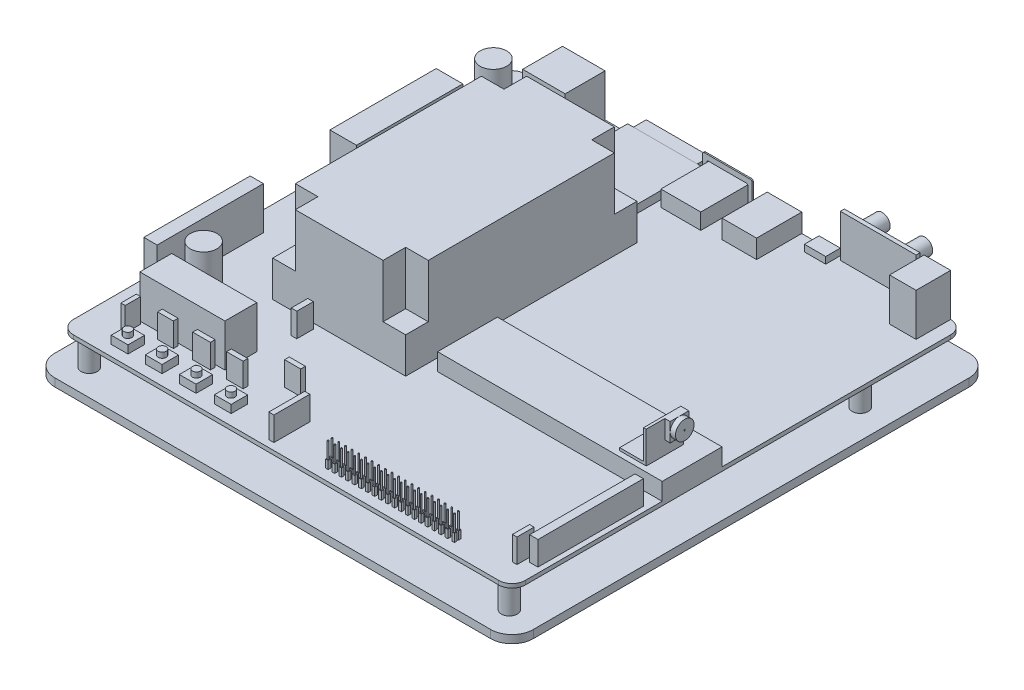
from build123d import *

# Parameters (mm, degrees)
RESSALTO_EXTRUS_O1_DEPTH  = 3
ESBO_O2_R                 = 3.5
RESSALTO_EXTRUS_O2_DEPTH  = 5
ESBO_O3_R                 = 3
RESSALTO_EXTRUS_O3_DEPTH  = 11
RESSALTO_EXTRUS_O4_DEPTH  = 1.5
ESBO_O5_W                 = 50
ESBO_O5_H                 = 87
RESSALTO_EXTRUS_O5_DEPTH  = 33.5
ESBO_O6_W                 = 8.5
ESBO_O6_H                 = 8.5
CORTE_EXTRUS_O1_DEPTH     = 20
ESBO_O7_W                 = 6.3
ESBO_O7_H                 = 6.2
RESSALTO_EXTRUS_O6_DEPTH  = 3
ESBO_O8_R                 = 1.5
RESSALTO_EXTRUS_O7_DEPTH  = 2
ESBO_O9_W                 = 1
ESBO_O9_H                 = 1
RESSALTO_EXTRUS_O8_DEPTH  = 3
ESBO_O10_R                = 0.25
RESSALTO_EXTRUS_O9_DEPTH  = 6
PADR_O_LINEAR1_COUNT      = 20
PADR_O_LINEAR1_PITCH      = 2.5
PADR_O_LINEAR1_COUNT_DIR2 = 2
PADR_O_LINEAR1_PITCH_DIR2 = 1.5
ESBO_O11_R                = 5
ESBO_O11_W                = 32
ESBO_O11_H                = 12
ESBO_O11_W_2              = 5
ESBO_O11_H_2              = 40
ESBO_O11_W_3              = 10
ESBO_O11_W_4              = 16
ESBO_O11_H_3              = 15
ESBO_O11_H_4              = 13
ESBO_O11_W_5              = 28.5
ESBO_O11_H_5              = 1.5
RESSALTO_EXTRUS_O10_DEPTH = 16
ESBO_O12_R                = 3
RESSALTO_EXTRUS_O11_DEPTH = 8
ESBO_O13_W                = 1.63158932
ESBO_O13_H                = 5.78472577
ESBO_O13_W_2              = 5.933052072
ESBO_O13_H_2              = 1.779915621
ESBO_O13_W_3              = 6.674683581
ESBO_O13_W_4              = 6.229704676
ESBO_O13_W_5              = 1.928241924
ESBO_O13_H_3              = 13.497693464
ESBO_O13_W_6              = 6.081378375
ESBO_O13_H_4              = 1.779915622
ESBO_O13_W_7              = 2.076568226
ESBO_O13_H_5              = 6.229704676
ESBO_O13_W_8              = 3.125695858
ESBO_O13_H_6              = 39.6558734
ESBO_O13_W_9              = 1.699808413
ESBO_O13_H_7              = 6.437326086
RESSALTO_EXTRUS_O12_DEPTH = 9
ESBO_O14_W                = 84.5
ESBO_O14_H                = 22.5
RESSALTO_EXTRUS_O13_DEPTH = 6.5
ESBO_O15_W                = 1
ESBO_O15_H                = 14
RESSALTO_EXTRUS_O14_DEPTH = 12
ESBO_O16_W                = 14
ESBO_O16_H                = 1
RESSALTO_EXTRUS_O15_DEPTH = 9
ESBO_O17_W                = 7
ESBO_O17_H                = 7
RESSALTO_EXTRUS_O16_DEPTH = 2
ESBO_O18_R                = 3.5
RESSALTO_EXTRUS_O17_DEPTH = 2
ESBO_O19_R                = 0.35
ESBO_O19_R_2              = 0.25
CORTE_EXTRUS_O2_DEPTH     = 0.2
RESSALTO_EXTRUS_O18_DEPTH = 3
ESBO_O21_W                = 24
ESBO_O21_H                = 0.2
CORTE_EXTRUS_O3_DEPTH     = 5
ESBO_O22_W                = 15
ESBO_O22_H                = 18
RESSALTO_EXTRUS_O19_DEPTH = 6
ESBO_O23_W                = 13
ESBO_O23_H                = 17
RESSALTO_EXTRUS_O20_DEPTH = 7
ESBO_O24_W                = 8
ESBO_O24_H                = 5.5
RESSALTO_EXTRUS_O21_DEPTH = 2.5
ESBO_O25_W                = 10
ESBO_O25_H                = 0.5
CORTE_EXTRUS_O4_DEPTH     = 8.5
RESSALTO_EXTRUS_O22_DEPTH = 0.5
ESBO_O27_W                = 12.6
ESBO_O27_H                = 6.6
ESBO_O27_W_2              = 10.6
ESBO_O27_H_2              = 1.5
CORTE_EXTRUS_O5_DEPTH     = 10
CORTE_EXTRUS_O6_DEPTH     = 4


with BuildPart() as part:
    # Esboço1 → Ressalto-extrusão1 (new body)
    with BuildSketch(Plane(origin=(0, 0, 0), x_dir=(1, 0, 0), z_dir=(0, 1, 0))):
        with BuildLine():
            Line((82, -90), (-82, -90))
            ThreePointArc((-82, -90), (-87.656854249, -87.656854249), (-90, -82))
            Line((-90, -82), (-90, 82))
            ThreePointArc((-90, 82), (-87.656854249, 87.656854249), (-82, 90))
            Line((-82, 90), (82, 90))
            ThreePointArc((82, 90), (87.656854249, 87.656854249), (90, 82))
            Line((90, 82), (90, -82))
            ThreePointArc((90, -82), (87.656854249, -87.656854249), (82, -90))
        make_face()
    extrude(amount=RESSALTO_EXTRUS_O1_DEPTH)

    # Esboço2 → Ressalto-extrusão2 (add)
    with BuildSketch(Plane(origin=(0, 0, 0), x_dir=(-1, 0, 0), z_dir=(0, -1, 0))):
        with Locations((79, -62)):
            Circle(ESBO_O2_R)
        with Locations((-79, -62)):
            Circle(ESBO_O2_R)
        with Locations((-79, 62)):
            Circle(ESBO_O2_R)
        with Locations((79, 62)):
            Circle(ESBO_O2_R)
    extrude(amount=RESSALTO_EXTRUS_O2_DEPTH)

    # Esboço3 → Ressalto-extrusão3 (add)
    with BuildSketch(Plane(origin=(0, 3, 0), x_dir=(1, 0, 0), z_dir=(0, 1, 0))):
        with Locations((-79, -80)):
            Circle(ESBO_O3_R)
        with Locations((-79, 75)):
            Circle(ESBO_O3_R)
        with Locations((79, 52)):
            Circle(ESBO_O3_R)
        with Locations((79, -80)):
            Circle(ESBO_O3_R)
    extrude(amount=RESSALTO_EXTRUS_O3_DEPTH)

    # Esboço4 → Ressalto-extrusão4 (add)
    with BuildSketch(Plane(origin=(0, 14, 0), x_dir=(1, 0, 0), z_dir=(0, 1, 0))):
        with BuildLine():
            Line((-80, 85), (80, 85))
            ThreePointArc((80, 85), (83.535533906, 83.535533906), (85, 80))
            Line((85, 80), (85, -80))
            ThreePointArc((85, -80), (83.535533906, -83.535533906), (80, -85))
            Line((80, -85), (-80, -85))
            ThreePointArc((-80, -85), (-83.535533906, -83.535533906), (-85, -80))
            Line((-85, -80), (-85, 80))
            ThreePointArc((-85, 80), (-83.535533906, 83.535533906), (-80, 85))
        make_face()
    extrude(amount=RESSALTO_EXTRUS_O4_DEPTH)

    # Esboço5 → Ressalto-extrusão5 (add)
    with BuildSketch(Plane(origin=(0, 15.5, 0), x_dir=(1, 0, 0), z_dir=(0, 1, 0))):
        with Locations((-29, 7.5)):
            Rectangle(ESBO_O5_W, ESBO_O5_H)
    extrude(amount=RESSALTO_EXTRUS_O5_DEPTH)

    # Esboço6 → Corte-extrusão1 (cut)
    with BuildSketch(Plane(origin=(0, 49, 0), x_dir=(1, 0, 0), z_dir=(0, 1, 0))):
        with Locations((-49.75, -31.75)):
            Rectangle(ESBO_O6_W, ESBO_O6_H)
        with Locations((-8.25, -31.75)):
            Rectangle(ESBO_O6_W, ESBO_O6_H)
        with Locations((-8.25, 46.75)):
            Rectangle(ESBO_O6_W, ESBO_O6_H)
        with Locations((-49.75, 46.75)):
            Rectangle(ESBO_O6_W, ESBO_O6_H)
    extrude(amount=-CORTE_EXTRUS_O1_DEPTH, mode=Mode.SUBTRACT)

    # Esboço7 → Ressalto-extrusão6 (add)
    with BuildSketch(Plane(origin=(0, 15.5, 0), x_dir=(1, 0, 0), z_dir=(0, 1, 0))):
        with Locations((-27.8, -77.9)):
            Rectangle(ESBO_O7_W, ESBO_O7_H)
        with Locations((-66.6, -77.9)):
            Rectangle(ESBO_O7_W, ESBO_O7_H)
        with Locations((-53.8, -77.9)):
            Rectangle(ESBO_O7_W, ESBO_O7_H)
        with Locations((-41, -77.9)):
            Rectangle(ESBO_O7_W, ESBO_O7_H)
    extrude(amount=RESSALTO_EXTRUS_O6_DEPTH)

    # Esboço8 → Ressalto-extrusão7 (add)
    with BuildSketch(Plane(origin=(0, 18.5, 0), x_dir=(1, 0, 0), z_dir=(0, 1, 0))):
        with Locations((-66.6, -77.9)):
            Circle(ESBO_O8_R)
        with Locations((-53.7, -77.9)):
            Circle(ESBO_O8_R)
        with Locations((-40.8, -77.9)):
            Circle(ESBO_O8_R)
        with Locations((-27.75, -77.95)):
            Circle(ESBO_O8_R)
    extrude(amount=RESSALTO_EXTRUS_O7_DEPTH)

    # Esboço9 → Ressalto-extrusão8 (add)
    with BuildSketch(Plane(origin=(0, 15.5, 0), x_dir=(1, 0, 0), z_dir=(0, 1, 0))):
        with Locations((11.35, -80.5)):
            Rectangle(ESBO_O9_W, ESBO_O9_H)
    ressalto_extrus_o8 = extrude(amount=RESSALTO_EXTRUS_O8_DEPTH)

    # Esboço10 → Ressalto-extrusão9 (add)
    with BuildSketch(Plane(origin=(0, 18.5, 0), x_dir=(1, 0, 0), z_dir=(0, 1, 0))):
        with Locations((11.35, -80.5)):
            Circle(ESBO_O10_R)
    ressalto_extrus_o9 = extrude(amount=RESSALTO_EXTRUS_O9_DEPTH)

    # Padrão linear1: Ressalto-extrusão8, Ressalto-extrus_o9 20 × 2
    with Locations(*[(i * PADR_O_LINEAR1_PITCH, 0, -j * PADR_O_LINEAR1_PITCH_DIR2) for i in range(PADR_O_LINEAR1_COUNT) for j in range(PADR_O_LINEAR1_COUNT_DIR2) if (i, j) != (0, 0)]):
        add(ressalto_extrus_o8)
        add(ressalto_extrus_o9)

    # Esboço11 → Ressalto-extrusão10 (add)
    with BuildSketch(Plane(origin=(0, 15.5, 0), x_dir=(1, 0, 0), z_dir=(0, 1, 0))):
        with Locations((-70, -46)):
            Circle(ESBO_O11_R)
        with Locations((-75, 68)):
            Circle(ESBO_O11_R)
        with Locations((-55.996597933, -62)):
            Rectangle(ESBO_O11_W, ESBO_O11_H)
        with Locations((-80, -36)):
            Rectangle(ESBO_O11_W_2, ESBO_O11_H_2)
        with Locations((-77.5, 34)):
            Rectangle(ESBO_O11_W_3, ESBO_O11_H_2)
        with Locations((-58, 77.5)):
            Rectangle(ESBO_O11_W_4, ESBO_O11_H_3)
        with Locations((75, 78.5)):
            Rectangle(ESBO_O11_W_3, ESBO_O11_H_4)
        with Locations((54.25, 84.25)):
            Rectangle(ESBO_O11_W_5, ESBO_O11_H_5)
    extrude(amount=RESSALTO_EXTRUS_O10_DEPTH)

    # Esboço12 → Ressalto-extrusão11 (add)
    with BuildSketch(Plane(origin=(0, 0, -85), x_dir=(-1, 0, 0), z_dir=(0, 0, -1))):
        with Locations((-62.25, 26.5)):
            Circle(ESBO_O12_R)
        with Locations((-46.25, 26.5)):
            Circle(ESBO_O12_R)
    extrude(amount=RESSALTO_EXTRUS_O11_DEPTH)

    # Esboço13 → Ressalto-extrusão12 (add)
    with BuildSketch(Plane(origin=(0, 15.5, 0), x_dir=(1, 0, 0), z_dir=(0, 1, 0))):
        with Locations((-71.610074729, -71.799389553)):
            Rectangle(ESBO_O13_W, ESBO_O13_H)
        with Locations((-59.669807433, -69.796984479)):
            Rectangle(ESBO_O13_W_2, ESBO_O13_H_2)
        with Locations((-46.097950818, -69.796984479)):
            Rectangle(ESBO_O13_W_3, ESBO_O13_H_2)
        with Locations((-33.564378314, -69.796984479)):
            Rectangle(ESBO_O13_W_4, ESBO_O13_H_2)
        with Locations((-8.126417554, -75.6558734)):
            Rectangle(ESBO_O13_W_5, ESBO_O13_H_3)
        with Locations((-20.140848001, -61.490711577)):
            Rectangle(ESBO_O13_W_6, ESBO_O13_H_4)
        with Locations((-37.717514765, -41.170008229)):
            Rectangle(ESBO_O13_W_7, ESBO_O13_H_5)
        with Locations((81.512220505, -53.483128012)):
            Rectangle(ESBO_O13_W_8, ESBO_O13_H_6)
        with Locations((77.452286259, -73.22538484)):
            Rectangle(ESBO_O13_W_9, ESBO_O13_H_7)
    extrude(amount=RESSALTO_EXTRUS_O12_DEPTH)

    # Esboço14 → Ressalto-extrusão13 (add)
    with BuildSketch(Plane(origin=(0, 15.5, 0), x_dir=(1, 0, 0), z_dir=(0, 1, 0))):
        with Locations((42.75, -17.25)):
            Rectangle(ESBO_O14_W, ESBO_O14_H)
    extrude(amount=RESSALTO_EXTRUS_O13_DEPTH)

    # Esboço15 → Ressalto-extrusão14 (add)
    with BuildSketch(Plane(origin=(0, 22, 0), x_dir=(1, 0, 0), z_dir=(0, 1, 0))):
        with Locations((76.5, -19.5)):
            Rectangle(ESBO_O15_W, ESBO_O15_H)
    extrude(amount=RESSALTO_EXTRUS_O14_DEPTH)

    # Esboço16 → Ressalto-extrusão15 (add)
    with BuildSketch(Plane.ZY.offset(-76)):
        with Locations((19.5, 22.5)):
            Rectangle(ESBO_O16_W, ESBO_O16_H)
    extrude(amount=RESSALTO_EXTRUS_O15_DEPTH)

    # Esboço17 → Ressalto-extrusão16 (add)
    with BuildSketch(Plane(origin=(77, 0, 0), x_dir=(0, 0, -1), z_dir=(1, 0, 0))):
        with Locations((-16, 30.5)):
            Rectangle(ESBO_O17_W, ESBO_O17_H)
    extrude(amount=RESSALTO_EXTRUS_O16_DEPTH)

    # Esboço18 → Ressalto-extrusão17 (add)
    with BuildSketch(Plane(origin=(79, 0, 0), x_dir=(0, 0, -1), z_dir=(1, 0, 0))):
        with Locations((-16, 30.5)):
            Circle(ESBO_O18_R)
    extrude(amount=RESSALTO_EXTRUS_O17_DEPTH)

    # Esboço19 → Corte-extrusão2 (cut)
    with BuildSketch(Plane(origin=(81, 0, 0), x_dir=(0, 0, -1), z_dir=(1, 0, 0))):
        with Locations((-16, 30.5)):
            Circle(ESBO_O19_R)
        with Locations((-16, 30.5)):
            Circle(ESBO_O19_R_2, mode=Mode.SUBTRACT)
    extrude(amount=-CORTE_EXTRUS_O2_DEPTH, mode=Mode.SUBTRACT)

    # Esboço20 → Ressalto-extrusão18 (add)
    with BuildSketch(Plane(origin=(0, 15.5, 0), x_dir=(1, 0, 0), z_dir=(0, 1, 0))):
        Polygon((-39.5, 85), (-41.5, 85), (-41.5, 56), (-13.5, 56), (-13.5, 85), (-15.5, 85), (-15.5, 90), (-39.5, 90), align=None)
    extrude(amount=RESSALTO_EXTRUS_O18_DEPTH)

    # Esboço21 → Corte-extrusão3 (cut)
    with BuildSketch(Plane(origin=(0, 0, -90), x_dir=(-1, 0, 0), z_dir=(0, 0, -1))):
        with Locations((27.5, 15.6)):
            Rectangle(ESBO_O21_W, ESBO_O21_H)
        with Locations((27.5, 18.4)):
            Rectangle(ESBO_O21_W, ESBO_O21_H)
    extrude(amount=-CORTE_EXTRUS_O3_DEPTH, mode=Mode.SUBTRACT)

    # Esboço22 → Ressalto-extrusão19 (add)
    with BuildSketch(Plane(origin=(0, 15.5, 0), x_dir=(1, 0, 0), z_dir=(0, 1, 0))):
        with Locations((-3.5, 76)):
            Rectangle(ESBO_O22_W, ESBO_O22_H)
    extrude(amount=RESSALTO_EXTRUS_O19_DEPTH)

    # Esboço23 → Ressalto-extrusão20 (add)
    with BuildSketch(Plane(origin=(0, 15.5, 0), x_dir=(1, 0, 0), z_dir=(0, 1, 0))):
        with Locations((17.5, 76.5)):
            Rectangle(ESBO_O23_W, ESBO_O23_H)
    extrude(amount=RESSALTO_EXTRUS_O20_DEPTH)

    # Esboço24 → Ressalto-extrusão21 (add)
    with BuildSketch(Plane(origin=(0, 15.5, 0), x_dir=(1, 0, 0), z_dir=(0, 1, 0))):
        with Locations((34.5, 82.25)):
            Rectangle(ESBO_O24_W, ESBO_O24_H)
    extrude(amount=RESSALTO_EXTRUS_O21_DEPTH)

    # Esboço25 → Corte-extrusão4 (cut)
    with BuildSketch(Plane(origin=(0, 0, -85), x_dir=(-1, 0, 0), z_dir=(0, 0, -1))):
        Polygon((-3.5, 20), (10.5, 20), (10.5, 17), (9, 15.5), (-2, 15.5), (-3.5, 17), align=None)
        with Locations((3.5, 17.75)):
            Rectangle(ESBO_O25_W, ESBO_O25_H, mode=Mode.SUBTRACT)
    extrude(amount=-CORTE_EXTRUS_O4_DEPTH, mode=Mode.SUBTRACT)

    # Esboço26 → Ressalto-extrusão22 (add)
    with BuildSketch(Plane(origin=(0, 0, -85), x_dir=(-1, 0, 0), z_dir=(0, 0, -1))):
        with BuildLine():
            Line((-4.2, 15.5), (-4.2, 21.5))
            ThreePointArc((-4.2, 21.5), (-4.053553391, 21.853553391), (-3.7, 22))
            Line((-3.7, 22), (10.7, 22))
            ThreePointArc((10.7, 22), (11.053553391, 21.853553391), (11.2, 21.5))
            Line((11.2, 21.5), (11.2, 15.5))
            Line((11.2, 15.5), (12.75, 15.5))
            Line((12.75, 15.5), (12.75, 23.5))
            ThreePointArc((12.75, 23.5), (12.603553391, 23.853553391), (12.25, 24))
            Line((12.25, 24), (-5.25, 24))
            ThreePointArc((-5.25, 24), (-5.603553391, 23.853553391), (-5.75, 23.5))
            Line((-5.75, 23.5), (-5.75, 15.5))
            Line((-5.75, 15.5), (-4.2, 15.5))
        make_face()
    extrude(amount=-RESSALTO_EXTRUS_O22_DEPTH)

    # Esboço27 → Corte-extrusão5 (cut)
    with BuildSketch(Plane(origin=(0, 0, -85), x_dir=(-1, 0, 0), z_dir=(0, 0, -1))):
        with Locations((-17.5, 19)):
            Rectangle(ESBO_O27_W, ESBO_O27_H)
        with Locations((-17.5, 20.55)):
            Rectangle(ESBO_O27_W_2, ESBO_O27_H_2, mode=Mode.SUBTRACT)
    extrude(amount=-CORTE_EXTRUS_O5_DEPTH, mode=Mode.SUBTRACT)

    # Esboço28 → Corte-extrusão6 (cut)
    with BuildSketch(Plane(origin=(0, 0, -85), x_dir=(-1, 0, 0), z_dir=(0, 0, -1))):
        with BuildLine():
            Line((-37.3, 17.8), (-31.7, 17.8))
            ThreePointArc((-31.7, 17.8), (-30.992893219, 17.507106781), (-30.7, 16.8))
            Line((-30.7, 16.8), (-30.7, 16.7))
            ThreePointArc((-30.7, 16.7), (-30.992893219, 15.992893219), (-31.7, 15.7))
            Line((-31.7, 15.7), (-37.3, 15.7))
            ThreePointArc((-37.3, 15.7), (-38.007106781, 15.992893219), (-38.3, 16.7))
            Line((-38.3, 16.7), (-38.3, 16.8))
            ThreePointArc((-38.3, 16.8), (-38.007106781, 17.507106781), (-37.3, 17.8))
        make_face()
    extrude(amount=-CORTE_EXTRUS_O6_DEPTH, mode=Mode.SUBTRACT)


solid = part.part
